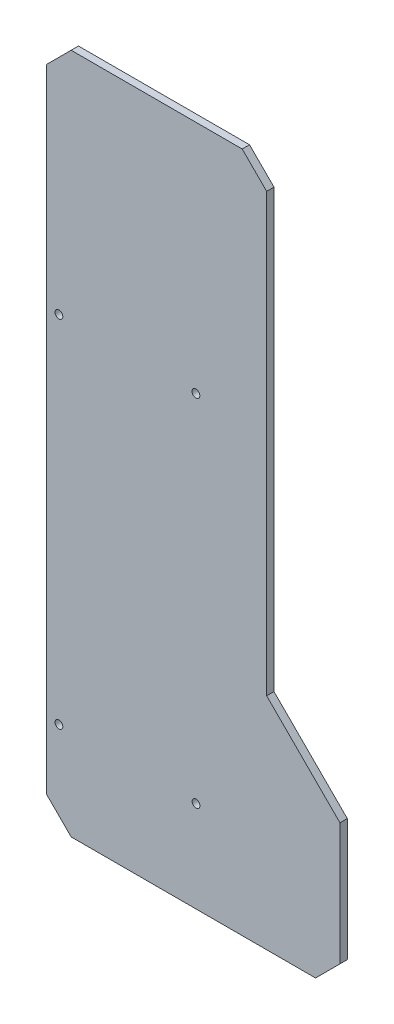
from build123d import *

# Parameters (mm, degrees)
SKETCH1_R      = 1.6
EXTRUDE1_DEPTH = 3


with BuildPart() as part:
    # Sketch1 → Extrude1 (new body)
    with BuildSketch(Plane.XY):
        Polygon((-70, 99.007889884), (0, 99.007889884), (10, 89.007889884), (10, -89.753959847), (40, -119.753959847), (40, -169.753959847), (30, -179.753959847), (0, -179.753959847), (-70, -179.753959847), (-80, -169.753959847), (-80, 89.007889884), align=None)
        with Locations((-75, 2.893545781)):
            Circle(SKETCH1_R, mode=Mode.SUBTRACT)
        with Locations((-18.946632771, 2.893545781)):
            Circle(SKETCH1_R, mode=Mode.SUBTRACT)
        with Locations((-75, -142.403959847)):
            Circle(SKETCH1_R, mode=Mode.SUBTRACT)
        with Locations((-18.893164364, -142.403959847)):
            Circle(SKETCH1_R, mode=Mode.SUBTRACT)
    extrude(amount=EXTRUDE1_DEPTH)


solid = part.part
